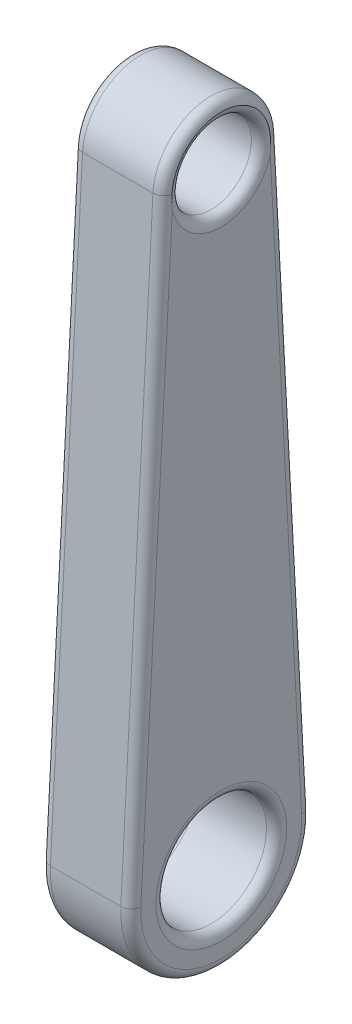
from build123d import *

# Parameters (mm, degrees)
SKETCH1_R           = 6.985
SKETCH1_R_2         = 5.08
BOSS_EXTRUDE1_DEPTH = 5.715
FILLET1_R           = 1.27


with BuildPart() as part:
    # Sketch1 → Boss-Extrude1 (new, symmetric)
    with BuildSketch(Plane(origin=(0, 0, 0), x_dir=(0, 0, -1), z_dir=(1, 0, 0))):
        with BuildLine():
            Line((-7.355516451, 76.592853333), (-11.413732424, 0.6096))
            ThreePointArc((-11.413732424, 0.6096), (0, -11.43), (11.413732424, 0.6096))
            Line((11.413732424, 0.6096), (7.355516451, 76.592853333))
            ThreePointArc((7.355516451, 76.592853333), (0, 83.566), (-7.355516451, 76.592853333))
        make_face()
        Circle(SKETCH1_R, mode=Mode.SUBTRACT)
        with Locations((0, 76.2)):
            Circle(SKETCH1_R_2, mode=Mode.SUBTRACT)
    extrude(amount=BOSS_EXTRUDE1_DEPTH, both=True)

    # Fillet1
    # the kernel refuses this fillet: 1.27 mm, written as the material it takes off along each edge
    with BuildSketch(Plane(origin=(-5.715, 0, 0), x_dir=(0, 0, -1), z_dir=(0, -1, 0))) as fillet1_piece_1:
        with BuildLine():
            CenterArc((6.985 + FILLET1_R, FILLET1_R), FILLET1_R, 180, 90)
            Line((6.985 + FILLET1_R, 0), (6.985, 0))
            Line((6.985, 0), (6.985, FILLET1_R))
        make_face()
    revolve(axis=Axis((-5.715, 0, 0), (1, 0, 0)), mode=Mode.SUBTRACT)
    with BuildSketch(Plane(origin=(5.715, 0, 0), x_dir=(0, 0, -1), z_dir=(0, -1, 0))) as fillet1_piece_2:
        with BuildLine():
            CenterArc((6.985 + FILLET1_R, -FILLET1_R), FILLET1_R, 90, 90)
            Line((6.985, -FILLET1_R), (6.985, 0))
            Line((6.985, 0), (6.985 + FILLET1_R, 0))
        make_face()
    revolve(axis=Axis((5.715, 0, 0), (1, 0, 0)), mode=Mode.SUBTRACT)
    with BuildSketch(Plane(origin=(5.715, 0, 0), x_dir=(0, 0.05333333333333351, 0.9985767649788149), z_dir=(0, 0.9985767649788149, -0.05333333333333351))) as fillet1_piece_3:
        with BuildLine():
            CenterArc((11.43 - FILLET1_R, -FILLET1_R), FILLET1_R, 0, 90)
            Line((11.43 - FILLET1_R, 0), (11.43, 0))
            Line((11.43, 0), (11.43, -FILLET1_R))
        make_face()
    revolve(axis=Axis((5.715, 0, 0), (1, 0, 0)), revolution_arc=186.114450857, mode=Mode.SUBTRACT)
    with BuildSketch(Plane(origin=(-5.715, 76.2, 0), x_dir=(0, 0, -1), z_dir=(0, -1, 0))) as fillet1_piece_4:
        with BuildLine():
            CenterArc((5.08 + FILLET1_R, FILLET1_R), FILLET1_R, 180, 90)
            Line((5.08 + FILLET1_R, 0), (5.08, 0))
            Line((5.08, 0), (5.08, FILLET1_R))
        make_face()
    revolve(axis=Axis((-5.715, 76.2, 0), (1, 0, 0)), mode=Mode.SUBTRACT)
    with BuildSketch(Plane(origin=(5.715, 76.2, 0), x_dir=(0, 0, -1), z_dir=(0, -1, 0))) as fillet1_piece_5:
        with BuildLine():
            CenterArc((5.08 + FILLET1_R, -FILLET1_R), FILLET1_R, 90, 90)
            Line((5.08, -FILLET1_R), (5.08, 0))
            Line((5.08, 0), (5.08 + FILLET1_R, 0))
        make_face()
    revolve(axis=Axis((5.715, 76.2, 0), (1, 0, 0)), mode=Mode.SUBTRACT)
    with BuildSketch(Plane(origin=(5.715, 0.6096, -11.413732424), x_dir=(-1, 0, 0), z_dir=(0, 0.9985767649788151, 0.05333333333333325)), Plane(origin=(5.715, 76.592853333, 7.355516451), x_dir=(-1, 0, 0), z_dir=(0, -0.9985767649788151, 0.053333333333333316))) as fillet1_piece_6:
        with BuildLine():
            CenterArc((FILLET1_R, FILLET1_R), FILLET1_R, 180, 90)
            Line((0, FILLET1_R), (0, 0))
            Line((0, 0), (FILLET1_R, 0))
        make_face()
    extrude(amount=76.091549491, mode=Mode.SUBTRACT)
    with BuildSketch(Plane(origin=(5.715, 76.2, 0), x_dir=(0, 0.05333333333333354, -0.9985767649788151), z_dir=(0, -0.9985767649788151, -0.05333333333333354))) as fillet1_piece_7:
        with BuildLine():
            CenterArc((7.366 - FILLET1_R, -FILLET1_R), FILLET1_R, 0, 90)
            Line((7.366, -FILLET1_R), (7.366, 0))
            Line((7.366, 0), (7.366 - FILLET1_R, 0))
        make_face()
    revolve(axis=Axis((5.715, 76.2, 0), (1, 0, 0)), revolution_arc=173.885549143, mode=Mode.SUBTRACT)
    with BuildSketch(Plane(origin=(-5.715, 0.6096, -11.413732424), x_dir=(1, 0, 0), z_dir=(0, 0.9985767649788151, 0.05333333333333325)), Plane(origin=(-5.715, 76.592853333, 7.355516451), x_dir=(1, 0, 0), z_dir=(0, -0.9985767649788151, 0.053333333333333316))) as fillet1_piece_8:
        with BuildLine():
            CenterArc((FILLET1_R, -FILLET1_R), FILLET1_R, 90, 90)
            Line((0, -FILLET1_R), (0, 0))
            Line((0, 0), (FILLET1_R, 0))
        make_face()
    extrude(amount=76.091549491, mode=Mode.SUBTRACT)
    with BuildSketch(Plane(origin=(-5.715, 0, 0), x_dir=(0, 0.05333333333333351, 0.9985767649788149), z_dir=(0, 0.9985767649788149, -0.05333333333333351))) as fillet1_piece_9:
        with BuildLine():
            CenterArc((11.43 - FILLET1_R, FILLET1_R), FILLET1_R, 270, 90)
            Line((11.43 - FILLET1_R, 0), (11.43, 0))
            Line((11.43, 0), (11.43, FILLET1_R))
        make_face()
    revolve(axis=Axis((-5.715, 0, 0), (1, 0, 0)), revolution_arc=186.114450857, mode=Mode.SUBTRACT)
    with BuildSketch(Plane(origin=(-5.715, 76.2, 0), x_dir=(0, 0.05333333333333354, -0.9985767649788151), z_dir=(0, -0.9985767649788151, -0.05333333333333354))) as fillet1_piece_10:
        with BuildLine():
            CenterArc((7.366 - FILLET1_R, FILLET1_R), FILLET1_R, 270, 90)
            Line((7.366 - FILLET1_R, 0), (7.366, 0))
            Line((7.366, 0), (7.366, FILLET1_R))
        make_face()
    revolve(axis=Axis((-5.715, 76.2, 0), (1, 0, 0)), revolution_arc=173.885549143, mode=Mode.SUBTRACT)


solid = part.part
